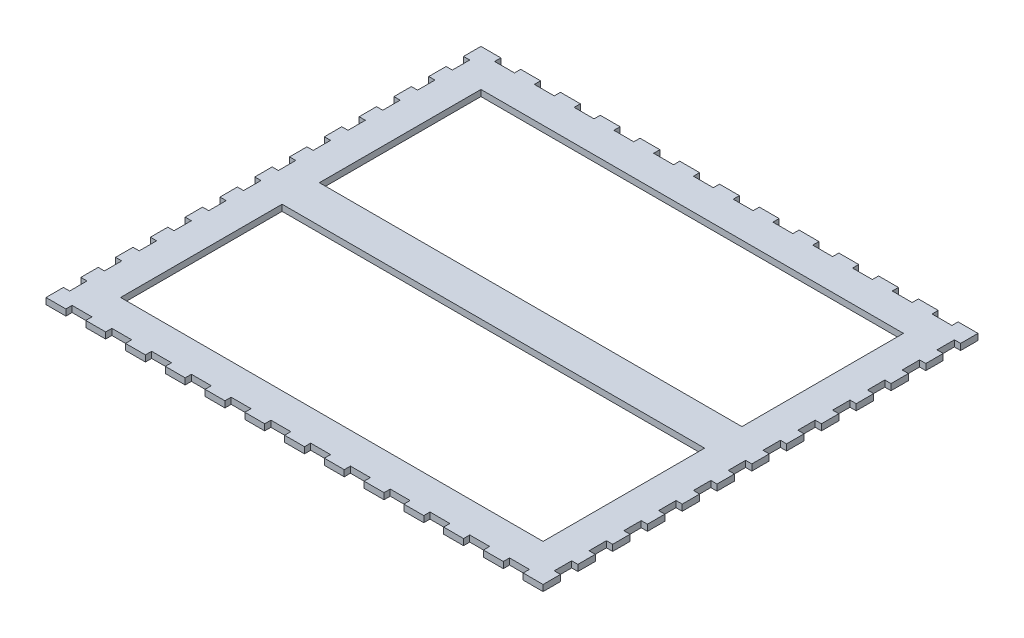
from build123d import *

# Parameters (mm, degrees)
ESQUISSE1_W                = 400
ESQUISSE1_H                = 350
BOSS_EXTRU_1_DEPTH         = 5
ESQUISSE2_W                = 16
ESQUISSE2_H                = 5
ENL_V_MAT_EXTRU_1_DEPTH    = 5
R_P_TITION_LIN_AIRE1_COUNT = 12
R_P_TITION_LIN_AIRE1_PITCH = 32
ESQUISSE3_W                = 5
ESQUISSE3_H                = 14
ENL_V_MAT_EXTRU_2_DEPTH    = 5
R_P_TITION_LIN_AIRE2_COUNT = 12
R_P_TITION_LIN_AIRE2_PITCH = 28
SYM_TRIE1_COPY_1_SKETCH_W  = 16
SYM_TRIE1_COPY_1_SKETCH_H  = 5
SYM_TRIE1_COPY_1_DEPTH     = 5
SYM_TRIE1_COPY_2_SKETCH_W  = 16
SYM_TRIE1_COPY_2_SKETCH_H  = 5
SYM_TRIE1_COPY_2_DEPTH     = 5
SYM_TRIE1_COPY_3_SKETCH_W  = 16
SYM_TRIE1_COPY_3_SKETCH_H  = 5
SYM_TRIE1_COPY_3_DEPTH     = 5
SYM_TRIE1_COPY_4_SKETCH_W  = 16
SYM_TRIE1_COPY_4_SKETCH_H  = 5
SYM_TRIE1_COPY_4_DEPTH     = 5
SYM_TRIE1_COPY_5_SKETCH_W  = 16
SYM_TRIE1_COPY_5_SKETCH_H  = 5
SYM_TRIE1_COPY_5_DEPTH     = 5
SYM_TRIE1_COPY_6_SKETCH_W  = 16
SYM_TRIE1_COPY_6_SKETCH_H  = 5
SYM_TRIE1_COPY_6_DEPTH     = 5
SYM_TRIE1_COPY_7_SKETCH_W  = 16
SYM_TRIE1_COPY_7_SKETCH_H  = 5
SYM_TRIE1_COPY_7_DEPTH     = 5
SYM_TRIE1_COPY_8_SKETCH_W  = 16
SYM_TRIE1_COPY_8_SKETCH_H  = 5
SYM_TRIE1_COPY_8_DEPTH     = 5
SYM_TRIE1_COPY_9_SKETCH_W  = 16
SYM_TRIE1_COPY_9_SKETCH_H  = 5
SYM_TRIE1_COPY_9_DEPTH     = 5
SYM_TRIE1_COPY_10_SKETCH_W = 16
SYM_TRIE1_COPY_10_SKETCH_H = 5
SYM_TRIE1_COPY_10_DEPTH    = 5
SYM_TRIE1_COPY_11_SKETCH_W = 16
SYM_TRIE1_COPY_11_SKETCH_H = 5
SYM_TRIE1_COPY_11_DEPTH    = 5
SYM_TRIE1_COPY_12_SKETCH_W = 16
SYM_TRIE1_COPY_12_SKETCH_H = 5
SYM_TRIE1_COPY_12_DEPTH    = 5
SYM_TRIE2_COPY_1_SKETCH_W  = 5
SYM_TRIE2_COPY_1_SKETCH_H  = 14
SYM_TRIE2_COPY_1_DEPTH     = 5
SYM_TRIE2_COPY_2_SKETCH_W  = 5
SYM_TRIE2_COPY_2_SKETCH_H  = 14
SYM_TRIE2_COPY_2_DEPTH     = 5
SYM_TRIE2_COPY_3_SKETCH_W  = 5
SYM_TRIE2_COPY_3_SKETCH_H  = 14
SYM_TRIE2_COPY_3_DEPTH     = 5
SYM_TRIE2_COPY_4_SKETCH_W  = 5
SYM_TRIE2_COPY_4_SKETCH_H  = 14
SYM_TRIE2_COPY_4_DEPTH     = 5
SYM_TRIE2_COPY_5_SKETCH_W  = 5
SYM_TRIE2_COPY_5_SKETCH_H  = 14
SYM_TRIE2_COPY_5_DEPTH     = 5
SYM_TRIE2_COPY_6_SKETCH_W  = 5
SYM_TRIE2_COPY_6_SKETCH_H  = 14
SYM_TRIE2_COPY_6_DEPTH     = 5
SYM_TRIE2_COPY_7_SKETCH_W  = 5
SYM_TRIE2_COPY_7_SKETCH_H  = 14
SYM_TRIE2_COPY_7_DEPTH     = 5
SYM_TRIE2_COPY_8_SKETCH_W  = 5
SYM_TRIE2_COPY_8_SKETCH_H  = 14
SYM_TRIE2_COPY_8_DEPTH     = 5
SYM_TRIE2_COPY_9_SKETCH_W  = 5
SYM_TRIE2_COPY_9_SKETCH_H  = 14
SYM_TRIE2_COPY_9_DEPTH     = 5
SYM_TRIE2_COPY_10_SKETCH_W = 5
SYM_TRIE2_COPY_10_SKETCH_H = 14
SYM_TRIE2_COPY_10_DEPTH    = 5
SYM_TRIE2_COPY_11_SKETCH_W = 5
SYM_TRIE2_COPY_11_SKETCH_H = 14
SYM_TRIE2_COPY_11_DEPTH    = 5
SYM_TRIE2_COPY_12_SKETCH_W = 5
SYM_TRIE2_COPY_12_SKETCH_H = 14
SYM_TRIE2_COPY_12_DEPTH    = 5
ESQUISSE4_W                = 340
ESQUISSE4_H                = 130
ENL_V_MAT_EXTRU_3_DEPTH    = 10


with BuildPart() as part:
    # Esquisse1 → Boss.-Extru.1 (new body)
    with BuildSketch(Plane(origin=(0, 0, 0), x_dir=(1, 0, 0), z_dir=(0, 1, 0))):
        with Locations((200, -175)):
            Rectangle(ESQUISSE1_W, ESQUISSE1_H)
    extrude(amount=BOSS_EXTRU_1_DEPTH)

    # Esquisse2 → Enlèv. mat.-Extru.1 (cut)
    with BuildSketch(Plane(origin=(0, 5, 0), x_dir=(1, 0, 0), z_dir=(0, 1, 0))):
        with Locations((24, -2.5)):
            Rectangle(ESQUISSE2_W, ESQUISSE2_H)
    enl_v_mat_extru_1 = extrude(amount=-ENL_V_MAT_EXTRU_1_DEPTH, mode=Mode.SUBTRACT)

    # Répétition linéaire1: Enlèv. mat.-Extru.1 ×12
    with Locations(*[(i * R_P_TITION_LIN_AIRE1_PITCH, 0, 0) for i in range(1, R_P_TITION_LIN_AIRE1_COUNT)]):
        add(enl_v_mat_extru_1, mode=Mode.SUBTRACT)

    # Esquisse3 → Enlèv. mat.-Extru.2 (cut)
    with BuildSketch(Plane(origin=(0, 5, 0), x_dir=(1, 0, 0), z_dir=(0, 1, 0))):
        with Locations((2.5, -21)):
            Rectangle(ESQUISSE3_W, ESQUISSE3_H)
    enl_v_mat_extru_2 = extrude(amount=-ENL_V_MAT_EXTRU_2_DEPTH, mode=Mode.SUBTRACT)

    # Répétition linéaire2: Enlèv. mat.-Extru.2 ×12
    with Locations(*[(0, 0, i * R_P_TITION_LIN_AIRE2_PITCH) for i in range(1, R_P_TITION_LIN_AIRE2_COUNT)]):
        add(enl_v_mat_extru_2, mode=Mode.SUBTRACT)

    # Symétrie1 copy 1 sketch → Symétrie1 copy 1 (cut)
    with BuildSketch(Plane(origin=(32, 5, 350), x_dir=(1, 0, 0), z_dir=(0, 1, 0))):
        with Locations((24, 2.5)):
            Rectangle(SYM_TRIE1_COPY_1_SKETCH_W, SYM_TRIE1_COPY_1_SKETCH_H)
    extrude(amount=-SYM_TRIE1_COPY_1_DEPTH, mode=Mode.SUBTRACT)

    # Symétrie1 copy 2 sketch → Symétrie1 copy 2 (cut)
    with BuildSketch(Plane(origin=(64, 5, 350), x_dir=(1, 0, 0), z_dir=(0, 1, 0))):
        with Locations((24, 2.5)):
            Rectangle(SYM_TRIE1_COPY_2_SKETCH_W, SYM_TRIE1_COPY_2_SKETCH_H)
    extrude(amount=-SYM_TRIE1_COPY_2_DEPTH, mode=Mode.SUBTRACT)

    # Symétrie1 copy 3 sketch → Symétrie1 copy 3 (cut)
    with BuildSketch(Plane(origin=(96, 5, 350), x_dir=(1, 0, 0), z_dir=(0, 1, 0))):
        with Locations((24, 2.5)):
            Rectangle(SYM_TRIE1_COPY_3_SKETCH_W, SYM_TRIE1_COPY_3_SKETCH_H)
    extrude(amount=-SYM_TRIE1_COPY_3_DEPTH, mode=Mode.SUBTRACT)

    # Symétrie1 copy 4 sketch → Symétrie1 copy 4 (cut)
    with BuildSketch(Plane(origin=(128, 5, 350), x_dir=(1, 0, 0), z_dir=(0, 1, 0))):
        with Locations((24, 2.5)):
            Rectangle(SYM_TRIE1_COPY_4_SKETCH_W, SYM_TRIE1_COPY_4_SKETCH_H)
    extrude(amount=-SYM_TRIE1_COPY_4_DEPTH, mode=Mode.SUBTRACT)

    # Symétrie1 copy 5 sketch → Symétrie1 copy 5 (cut)
    with BuildSketch(Plane(origin=(160, 5, 350), x_dir=(1, 0, 0), z_dir=(0, 1, 0))):
        with Locations((24, 2.5)):
            Rectangle(SYM_TRIE1_COPY_5_SKETCH_W, SYM_TRIE1_COPY_5_SKETCH_H)
    extrude(amount=-SYM_TRIE1_COPY_5_DEPTH, mode=Mode.SUBTRACT)

    # Symétrie1 copy 6 sketch → Symétrie1 copy 6 (cut)
    with BuildSketch(Plane(origin=(192, 5, 350), x_dir=(1, 0, 0), z_dir=(0, 1, 0))):
        with Locations((24, 2.5)):
            Rectangle(SYM_TRIE1_COPY_6_SKETCH_W, SYM_TRIE1_COPY_6_SKETCH_H)
    extrude(amount=-SYM_TRIE1_COPY_6_DEPTH, mode=Mode.SUBTRACT)

    # Symétrie1 copy 7 sketch → Symétrie1 copy 7 (cut)
    with BuildSketch(Plane(origin=(224, 5, 350), x_dir=(1, 0, 0), z_dir=(0, 1, 0))):
        with Locations((24, 2.5)):
            Rectangle(SYM_TRIE1_COPY_7_SKETCH_W, SYM_TRIE1_COPY_7_SKETCH_H)
    extrude(amount=-SYM_TRIE1_COPY_7_DEPTH, mode=Mode.SUBTRACT)

    # Symétrie1 copy 8 sketch → Symétrie1 copy 8 (cut)
    with BuildSketch(Plane(origin=(256, 5, 350), x_dir=(1, 0, 0), z_dir=(0, 1, 0))):
        with Locations((24, 2.5)):
            Rectangle(SYM_TRIE1_COPY_8_SKETCH_W, SYM_TRIE1_COPY_8_SKETCH_H)
    extrude(amount=-SYM_TRIE1_COPY_8_DEPTH, mode=Mode.SUBTRACT)

    # Symétrie1 copy 9 sketch → Symétrie1 copy 9 (cut)
    with BuildSketch(Plane(origin=(288, 5, 350), x_dir=(1, 0, 0), z_dir=(0, 1, 0))):
        with Locations((24, 2.5)):
            Rectangle(SYM_TRIE1_COPY_9_SKETCH_W, SYM_TRIE1_COPY_9_SKETCH_H)
    extrude(amount=-SYM_TRIE1_COPY_9_DEPTH, mode=Mode.SUBTRACT)

    # Symétrie1 copy 10 sketch → Symétrie1 copy 10 (cut)
    with BuildSketch(Plane(origin=(320, 5, 350), x_dir=(1, 0, 0), z_dir=(0, 1, 0))):
        with Locations((24, 2.5)):
            Rectangle(SYM_TRIE1_COPY_10_SKETCH_W, SYM_TRIE1_COPY_10_SKETCH_H)
    extrude(amount=-SYM_TRIE1_COPY_10_DEPTH, mode=Mode.SUBTRACT)

    # Symétrie1 copy 11 sketch → Symétrie1 copy 11 (cut)
    with BuildSketch(Plane(origin=(352, 5, 350), x_dir=(1, 0, 0), z_dir=(0, 1, 0))):
        with Locations((24, 2.5)):
            Rectangle(SYM_TRIE1_COPY_11_SKETCH_W, SYM_TRIE1_COPY_11_SKETCH_H)
    extrude(amount=-SYM_TRIE1_COPY_11_DEPTH, mode=Mode.SUBTRACT)

    # Symétrie1 copy 12 sketch → Symétrie1 copy 12 (cut)
    with BuildSketch(Plane(origin=(0, 5, 350), x_dir=(1, 0, 0), z_dir=(0, 1, 0))):
        with Locations((24, 2.5)):
            Rectangle(SYM_TRIE1_COPY_12_SKETCH_W, SYM_TRIE1_COPY_12_SKETCH_H)
    extrude(amount=-SYM_TRIE1_COPY_12_DEPTH, mode=Mode.SUBTRACT)

    # Symétrie2 copy 1 sketch → Symétrie2 copy 1 (cut)
    with BuildSketch(Plane(origin=(400, 5, 28), x_dir=(-1, 0, 0), z_dir=(0, 1, 0))):
        with Locations((2.5, 21)):
            Rectangle(SYM_TRIE2_COPY_1_SKETCH_W, SYM_TRIE2_COPY_1_SKETCH_H)
    extrude(amount=-SYM_TRIE2_COPY_1_DEPTH, mode=Mode.SUBTRACT)

    # Symétrie2 copy 2 sketch → Symétrie2 copy 2 (cut)
    with BuildSketch(Plane(origin=(400, 5, 56), x_dir=(-1, 0, 0), z_dir=(0, 1, 0))):
        with Locations((2.5, 21)):
            Rectangle(SYM_TRIE2_COPY_2_SKETCH_W, SYM_TRIE2_COPY_2_SKETCH_H)
    extrude(amount=-SYM_TRIE2_COPY_2_DEPTH, mode=Mode.SUBTRACT)

    # Symétrie2 copy 3 sketch → Symétrie2 copy 3 (cut)
    with BuildSketch(Plane(origin=(400, 5, 84), x_dir=(-1, 0, 0), z_dir=(0, 1, 0))):
        with Locations((2.5, 21)):
            Rectangle(SYM_TRIE2_COPY_3_SKETCH_W, SYM_TRIE2_COPY_3_SKETCH_H)
    extrude(amount=-SYM_TRIE2_COPY_3_DEPTH, mode=Mode.SUBTRACT)

    # Symétrie2 copy 4 sketch → Symétrie2 copy 4 (cut)
    with BuildSketch(Plane(origin=(400, 5, 112), x_dir=(-1, 0, 0), z_dir=(0, 1, 0))):
        with Locations((2.5, 21)):
            Rectangle(SYM_TRIE2_COPY_4_SKETCH_W, SYM_TRIE2_COPY_4_SKETCH_H)
    extrude(amount=-SYM_TRIE2_COPY_4_DEPTH, mode=Mode.SUBTRACT)

    # Symétrie2 copy 5 sketch → Symétrie2 copy 5 (cut)
    with BuildSketch(Plane(origin=(400, 5, 140), x_dir=(-1, 0, 0), z_dir=(0, 1, 0))):
        with Locations((2.5, 21)):
            Rectangle(SYM_TRIE2_COPY_5_SKETCH_W, SYM_TRIE2_COPY_5_SKETCH_H)
    extrude(amount=-SYM_TRIE2_COPY_5_DEPTH, mode=Mode.SUBTRACT)

    # Symétrie2 copy 6 sketch → Symétrie2 copy 6 (cut)
    with BuildSketch(Plane(origin=(400, 5, 168), x_dir=(-1, 0, 0), z_dir=(0, 1, 0))):
        with Locations((2.5, 21)):
            Rectangle(SYM_TRIE2_COPY_6_SKETCH_W, SYM_TRIE2_COPY_6_SKETCH_H)
    extrude(amount=-SYM_TRIE2_COPY_6_DEPTH, mode=Mode.SUBTRACT)

    # Symétrie2 copy 7 sketch → Symétrie2 copy 7 (cut)
    with BuildSketch(Plane(origin=(400, 5, 196), x_dir=(-1, 0, 0), z_dir=(0, 1, 0))):
        with Locations((2.5, 21)):
            Rectangle(SYM_TRIE2_COPY_7_SKETCH_W, SYM_TRIE2_COPY_7_SKETCH_H)
    extrude(amount=-SYM_TRIE2_COPY_7_DEPTH, mode=Mode.SUBTRACT)

    # Symétrie2 copy 8 sketch → Symétrie2 copy 8 (cut)
    with BuildSketch(Plane(origin=(400, 5, 224), x_dir=(-1, 0, 0), z_dir=(0, 1, 0))):
        with Locations((2.5, 21)):
            Rectangle(SYM_TRIE2_COPY_8_SKETCH_W, SYM_TRIE2_COPY_8_SKETCH_H)
    extrude(amount=-SYM_TRIE2_COPY_8_DEPTH, mode=Mode.SUBTRACT)

    # Symétrie2 copy 9 sketch → Symétrie2 copy 9 (cut)
    with BuildSketch(Plane(origin=(400, 5, 252), x_dir=(-1, 0, 0), z_dir=(0, 1, 0))):
        with Locations((2.5, 21)):
            Rectangle(SYM_TRIE2_COPY_9_SKETCH_W, SYM_TRIE2_COPY_9_SKETCH_H)
    extrude(amount=-SYM_TRIE2_COPY_9_DEPTH, mode=Mode.SUBTRACT)

    # Symétrie2 copy 10 sketch → Symétrie2 copy 10 (cut)
    with BuildSketch(Plane(origin=(400, 5, 280), x_dir=(-1, 0, 0), z_dir=(0, 1, 0))):
        with Locations((2.5, 21)):
            Rectangle(SYM_TRIE2_COPY_10_SKETCH_W, SYM_TRIE2_COPY_10_SKETCH_H)
    extrude(amount=-SYM_TRIE2_COPY_10_DEPTH, mode=Mode.SUBTRACT)

    # Symétrie2 copy 11 sketch → Symétrie2 copy 11 (cut)
    with BuildSketch(Plane(origin=(400, 5, 308), x_dir=(-1, 0, 0), z_dir=(0, 1, 0))):
        with Locations((2.5, 21)):
            Rectangle(SYM_TRIE2_COPY_11_SKETCH_W, SYM_TRIE2_COPY_11_SKETCH_H)
    extrude(amount=-SYM_TRIE2_COPY_11_DEPTH, mode=Mode.SUBTRACT)

    # Symétrie2 copy 12 sketch → Symétrie2 copy 12 (cut)
    with BuildSketch(Plane(origin=(400, 5, 0), x_dir=(-1, 0, 0), z_dir=(0, 1, 0))):
        with Locations((2.5, 21)):
            Rectangle(SYM_TRIE2_COPY_12_SKETCH_W, SYM_TRIE2_COPY_12_SKETCH_H)
    extrude(amount=-SYM_TRIE2_COPY_12_DEPTH, mode=Mode.SUBTRACT)

    # Esquisse4 → Enlèv. mat.-Extru.3 (cut)
    with BuildSketch(Plane(origin=(0, 5, 0), x_dir=(1, 0, 0), z_dir=(0, 1, 0))):
        with Locations((200, -95)):
            Rectangle(ESQUISSE4_W, ESQUISSE4_H)
    enl_v_mat_extru_3 = extrude(amount=-ENL_V_MAT_EXTRU_3_DEPTH, mode=Mode.SUBTRACT)

    # Symétrie3: Enlèv. mat.-Extru.3 across plane
    add(enl_v_mat_extru_3.mirror(Plane(origin=(0, 0, 175), x_dir=(1, 0, 0), z_dir=(0, 0, -1))), mode=Mode.SUBTRACT)


solid = part.part
